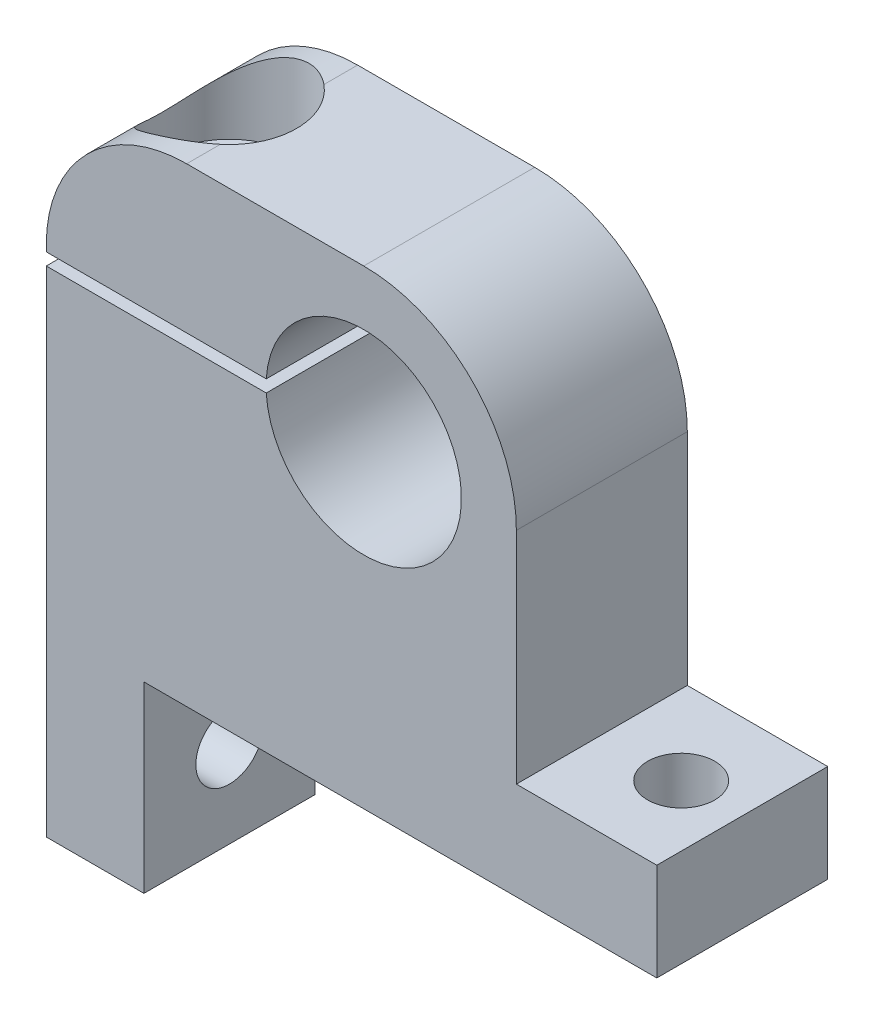
from build123d import *

# Parameters (mm, degrees)
EXTRUDE_1_DEPTH               = 14
SKETCH_2_R                    = 2.75
CUT_EXTRUDE_1_DEPTH           = 49.520614176
SKETCH_3_R                    = 2.75
CUT_EXTRUDE_2_DEPTH           = 67.158899628
HOLE_START                    = 5.1
HOLE_WIZARD_M61_OUTLINE_R     = 5.5
HOLE_WIZARD_M61_DEPTH         = 7.4
HOLE_START_2                  = 0.5
HOLE_WIZARD_M61_2_OUTLINE_R   = 3.3
HOLE_WIZARD_M61_2_DEPTH       = 4.6
HOLE_WIZARD_M61_3_D           = 5
HOLE_WIZARD_M61_3_DEPTH       = 17
HOLE_WIZARD_M61_3_CSINK_D     = 6.05
HOLE_WIZARD_M61_3_CSINK_ANGLE = 120
HOLE_WIZARD_M61_3_TIP         = 1.502151548


# Read off the part's stored shape, not the designer's step: Цековка для  винта с внутренним шестигранником M61
with BuildPart() as part:
    # Эскиз1 → Бобышка-Вытянуть1 (new body)
    with BuildSketch(Plane.XY):
        with BuildLine():
            Line((-26, 0.5), (-7.984359711, 0.5))
            ThreePointArc((-7.984359711, 0.5), (8, 0), (-7.984359711, -0.5))
            Line((-7.984359711, -0.5), (-26, -0.5))
            Line((-26, -0.5), (-26, -18))
            Line((-26, -18), (-26, -26))
            Line((-26, -26), (-26, -41))
            Line((-26, -41), (-18, -41))
            Line((-18, -41), (-18, -26))
            Line((-18, -26), (24, -26))
            Line((24, -26), (24, -18))
            Line((24, -18), (12.5, -18))
            Line((12.5, -18), (12.5, 0))
            ThreePointArc((12.5, 0), (8.838834765, 8.838834765), (0, 12.5))
            Line((0, 12.5), (-14.5, 12.5))
            ThreePointArc((-14.5, 12.5), (-22.631727984, 9.131727984), (-26, 1))
            Line((-26, 1), (-26, 0.5))
        make_face()
    extrude(amount=EXTRUDE_1_DEPTH)

    # Эскиз2 → Вырез-Вытянуть1 (cut, through all)
    with BuildSketch(Plane.XZ.offset(26)):
        with Locations(Location((19, 7, 0), (0, 0, 270))):
            Circle(SKETCH_2_R)
    extrude(amount=-CUT_EXTRUDE_1_DEPTH, mode=Mode.SUBTRACT)

    # Эскиз3 → Вырез-Вытянуть2 (cut, through all)
    with BuildSketch(Plane.ZY.offset(26)):
        with Locations((7, -34)):
            Circle(SKETCH_3_R)
    extrude(amount=-CUT_EXTRUDE_2_DEPTH, mode=Mode.SUBTRACT)

    # Hole Wizard M61 outline → Hole Wizard M61 (cut)
    with BuildSketch(Plane(origin=(0, 0, 0), x_dir=(1, 0, 0), z_dir=(0, 1, 0)).offset(HOLE_START)):
        with Locations((-18, -7)):
            Circle(HOLE_WIZARD_M61_OUTLINE_R)
    extrude(amount=HOLE_WIZARD_M61_DEPTH, mode=Mode.SUBTRACT)

    # Hole Wizard M61 2 outline → Hole Wizard M61 2 (cut)
    with BuildSketch(Plane(origin=(0, 0, 0), x_dir=(1, 0, 0), z_dir=(0, 1, 0)).offset(HOLE_START_2)):
        with Locations((-18, -7)):
            Circle(HOLE_WIZARD_M61_2_OUTLINE_R)
    extrude(amount=HOLE_WIZARD_M61_2_DEPTH, mode=Mode.SUBTRACT)

    # Hole Wizard M61 3
    with Locations(Plane(origin=(0, -0.5, 0), x_dir=(-1, 0, 0), z_dir=(0, 1, 0))):
        with Locations((18, 7)):
            CounterSinkHole(HOLE_WIZARD_M61_3_D / 2, HOLE_WIZARD_M61_3_CSINK_D / 2, depth=HOLE_WIZARD_M61_3_DEPTH, counter_sink_angle=HOLE_WIZARD_M61_3_CSINK_ANGLE)
            with Locations((0, 0, -(HOLE_WIZARD_M61_3_DEPTH + HOLE_WIZARD_M61_3_TIP / 2))):  # 118° drill point
                Cone(0, HOLE_WIZARD_M61_3_D / 2, HOLE_WIZARD_M61_3_TIP, mode=Mode.SUBTRACT)


solid = part.part
